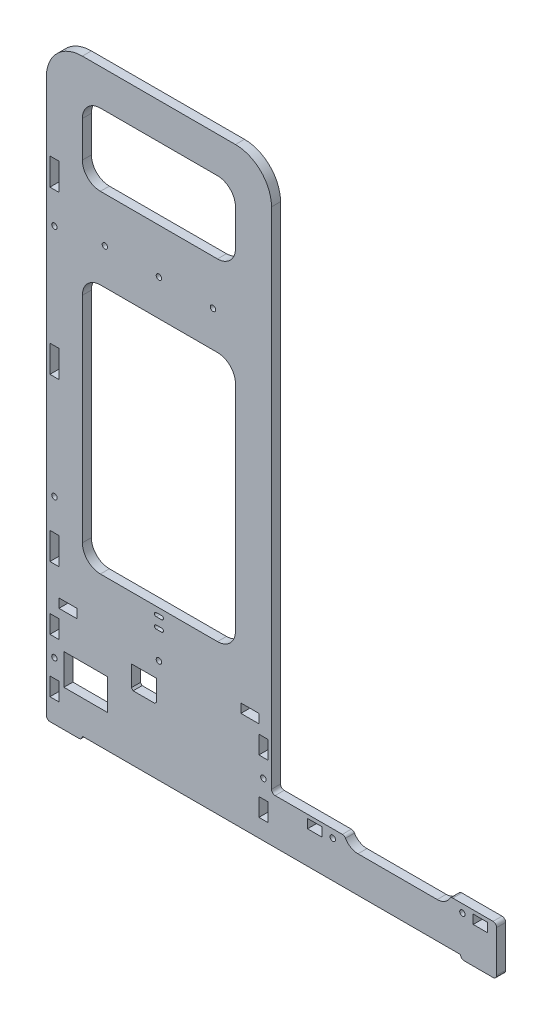
from build123d import *

# Parameters (mm, degrees)
BOSS_EXTRUDE1_DEPTH = 5
SKETCH7_W           = 14
SKETCH7_H           = 12.5
CUT_EXTRUDE4_DEPTH  = 259.110441478
SKETCH3_W           = 125
SKETCH3_H           = 265
BOSS_EXTRUDE2_DEPTH = 5
SKETCH4_W           = 85
SKETCH4_H           = 40
SKETCH4_H_2         = 139
CUT_EXTRUDE2_DEPTH  = 414.238429965
SKETCH2_R           = 1.5
SKETCH2_W           = 10
SKETCH2_H           = 5
SKETCH2_W_2         = 8
SKETCH2_W_3         = 5
SKETCH2_H_2         = 10
SKETCH2_W_4         = 210
SKETCH2_H_3         = 2
SKETCH2_H_4         = 15
CUT_EXTRUDE1_DEPTH  = 414.238429965
SKETCH5_R           = 1.5
CUT_EXTRUDE3_DEPTH  = 414.238429965
FILLET1_R           = 2
FILLET2_R           = 10
FILLET3_R           = 20
CHAMFER1_SIZE       = 1


with BuildPart() as part:
    # Sketch1 → Boss-Extrude1 (new body)
    with BuildSketch(Plane.XY):
        Polygon((0, 0), (0, 64), (125, 64), (125, 27), (250, 27), (250, 0), align=None)
    extrude(amount=BOSS_EXTRUDE1_DEPTH)

    # Sketch7 → Cut-Extrude4 (cut, through all)
    with BuildSketch(Plane.XY.offset(5)):
        with Locations((54.2, 44.19)):
            Rectangle(SKETCH7_W, SKETCH7_H)
        Polygon((9.74, 28.1), (9.74, 20.4), (34.06, 20.4), (34.06, 28.1), (34.06, 37.6), (9.74, 37.6), align=None)
    extrude(amount=-CUT_EXTRUDE4_DEPTH, mode=Mode.SUBTRACT)

    # Sketch3 → Boss-Extrude2 (add)
    with BuildSketch(Plane.XY.offset(5)):
        with Locations((62.5, 196.5)):
            Rectangle(SKETCH3_W, SKETCH3_H)
    extrude(amount=-BOSS_EXTRUDE2_DEPTH)

    # Sketch4 → Cut-Extrude2 (cut, through all)
    with BuildSketch(Plane.XY.offset(5)):
        with Locations((62.5, 289)):
            Rectangle(SKETCH4_W, SKETCH4_H)
        with Locations((62.5, 154.5)):
            Rectangle(SKETCH4_W, SKETCH4_H_2)
    extrude(amount=-CUT_EXTRUDE2_DEPTH, mode=Mode.SUBTRACT)

    # Sketch2 → Cut-Extrude1 (cut, through all)
    with BuildSketch(Plane.XY.offset(5)):
        with Locations((4.5, 32)):
            Circle(SKETCH2_R)
        with Locations((62.5, 59.5)):
            Circle(SKETCH2_R)
        with Locations(Location((120.5, 32, 0), (0, 0, 180))):
            Circle(SKETCH2_R)
        with Locations((159, 22.5)):
            Circle(SKETCH2_R)
        with Locations(Location((231, 22.5, 0), (0, 0, 180))):
            Circle(SKETCH2_R)
        with Locations((4.5, 109.5)):
            Circle(SKETCH2_R)
        with Locations((4.5, 239.5)):
            Circle(SKETCH2_R)
        with Locations((12, 59.5)):
            Rectangle(SKETCH2_W, SKETCH2_H)
        with Locations((113, 59.5)):
            Rectangle(SKETCH2_W, SKETCH2_H)
        with Locations((241, 22.5)):
            Rectangle(SKETCH2_W_2, SKETCH2_H)
        with Locations((149, 22.5)):
            Rectangle(SKETCH2_W_2, SKETCH2_H)
        with Locations((120.5, 47)):
            Rectangle(SKETCH2_W_3, SKETCH2_H_2)
        with Locations((120.5, 17)):
            Rectangle(SKETCH2_W_3, SKETCH2_H_2)
        with Locations((4.5, 17)):
            Rectangle(SKETCH2_W_3, SKETCH2_H_2)
        with Locations((4.5, 47)):
            Rectangle(SKETCH2_W_3, SKETCH2_H_2)
        with BuildLine():
            Line((173, 22), (217, 22))
            ThreePointArc((217, 22), (225, 30), (217, 38))
            Line((217, 38), (173, 38))
            ThreePointArc((173, 38), (165, 30), (173, 22))
        make_face()
        with Locations((125, 1)):
            Rectangle(SKETCH2_W_4, SKETCH2_H_3)
        with Locations((4.5, 84.5)):
            Rectangle(SKETCH2_W_3, SKETCH2_H_4)
        with Locations((4.5, 264.5)):
            Rectangle(SKETCH2_W_3, SKETCH2_H_4)
        with Locations((4.5, 174.5)):
            Rectangle(SKETCH2_W_3, SKETCH2_H_4)
        with BuildLine():
            Line((61, 82), (64, 82))
            ThreePointArc((64, 82), (65, 81), (64, 80))
            Line((64, 80), (61, 80))
            ThreePointArc((61, 80), (60, 81), (61, 82))
        make_face()
        with BuildLine():
            Line((61, 76), (64, 76))
            ThreePointArc((64, 76), (65, 75), (64, 74))
            Line((64, 74), (61, 74))
            ThreePointArc((61, 74), (60, 75), (61, 76))
        make_face()
    extrude(amount=-CUT_EXTRUDE1_DEPTH, mode=Mode.SUBTRACT)

    # Sketch5 → Cut-Extrude3 (cut, through all)
    with BuildSketch(Plane(origin=(0, 0, 0), x_dir=(-1, 0, 0), z_dir=(0, 0, -1))):
        with Locations((-92.5, 244)):
            Circle(SKETCH5_R)
        with Locations((-62.5, 244)):
            Circle(SKETCH5_R)
        with Locations((-32.5, 244)):
            Circle(SKETCH5_R)
    extrude(amount=-CUT_EXTRUDE3_DEPTH, mode=Mode.SUBTRACT)

    # Fillet1
    fillet1_edges = [part.edges().sort_by_distance(p)[0] for p in [
        (250, 0, 2.5),
        (250, 27, 2.5),
        (0, 0, 2.5),
        (125, 27, 2.5),
        (224.416198487, 27, 2.5),
        (165.583801513, 27, 2.5),
        (230, 0, 2.5),
        (20, 0, 2.5),
    ]]
    fillet(fillet1_edges, radius=FILLET1_R - 0.0001)  # a hair under: the kernel refuses the full size

    # Fillet2
    fillet2_edges = [part.edges().sort_by_distance(p)[0] for p in [
        (20, 269, 2.5),
        (20, 309, 2.5),
        (105, 309, 2.5),
        (105, 269, 2.5),
        (105, 224, 2.5),
        (105, 85, 2.5),
        (20, 85, 2.5),
        (20, 224, 2.5),
    ]]
    fillet(fillet2_edges, radius=FILLET2_R)

    # Fillet3
    fillet3_edges = [part.edges().sort_by_distance(p)[0] for p in [
        (125, 329, 2.5),
        (0, 329, 2.5),
    ]]
    fillet(fillet3_edges, radius=FILLET3_R)

    # Chamfer1
    chamfer1_edges = [part.edges().sort_by_distance(p)[0] for p in [
        (47.2, 37.94, 2.5),
        (61.2, 37.94, 2.5),
    ]]
    chamfer(chamfer1_edges, length=CHAMFER1_SIZE)


solid = part.part
